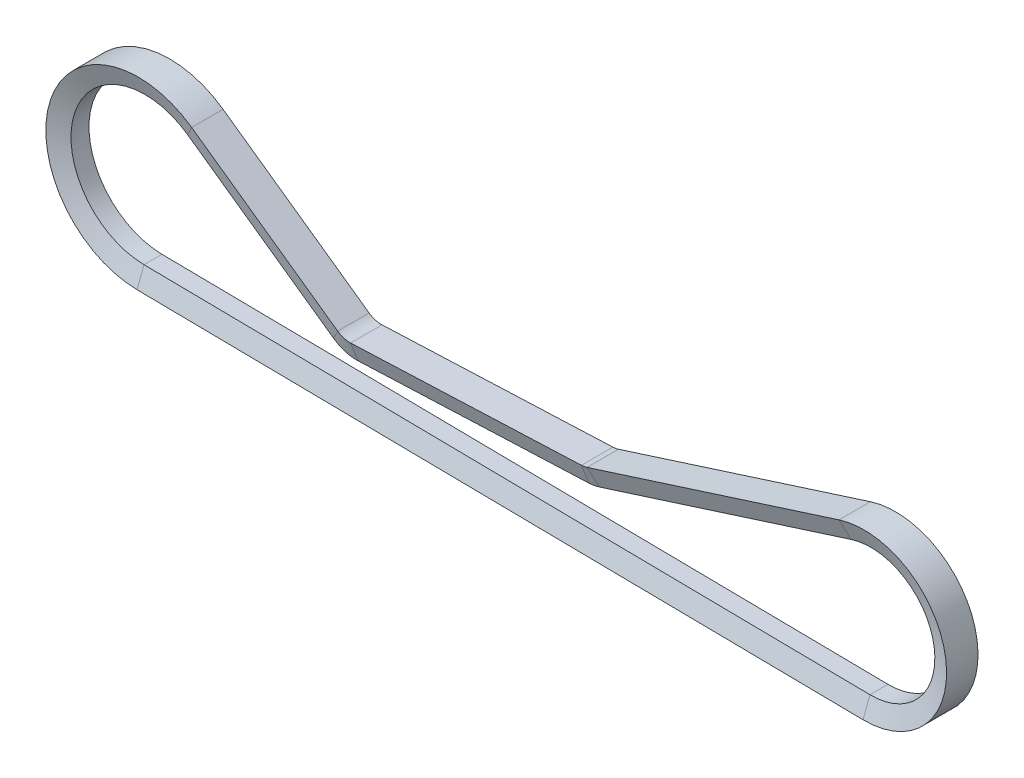
from build123d import *


with BuildPart() as part:
    # Sweep1: sweep along a path in Sketch2
    with BuildLine(Plane.XY) as sweep1_path:
        Line((-0.32462909, -24.99789223), (-220.285626944, -22.14142186))
        ThreePointArc((-220.285626944, -22.14142186), (-246.549449192, 14.515386312), (-203.74809723, 28.712365382))
        Line((-203.74809723, 28.712365382), (-159.4935732, -2.603945894))
        ThreePointArc((-159.4935732, -2.603945894), (-157.624935262, -3.510220979), (-155.563824399, -3.765101896))
        Line((-155.563824399, -3.765101896), (-85.623309635, -0.879899205))
        ThreePointArc((-85.623309635, -0.879899205), (-84.777724495, -0.788003193), (-83.952006589, -0.583922211))
        Line((-83.952006589, -0.583922211), (-7.610362785, 23.813491518))
        ThreePointArc((-7.610362785, 23.813491518), (24.726075707, 3.6906883), (-0.32462909, -24.99789223))
    # Sketch3 → Sweep1 (sweep)
    with BuildSketch(Plane(origin=(-7.610362785, 23.813491518, 0), x_dir=(0.3044145113802444, -0.9525396607286897, 0), z_dir=(0.9525396607286897, 0.3044145113802444, 0))):
        Polygon((0, -4.7625), (0, 4.7625), (5.588, 2.728634331), (5.588, -2.728634331), align=None)
    sweep(path=sweep1_path.line)


solid = part.part
